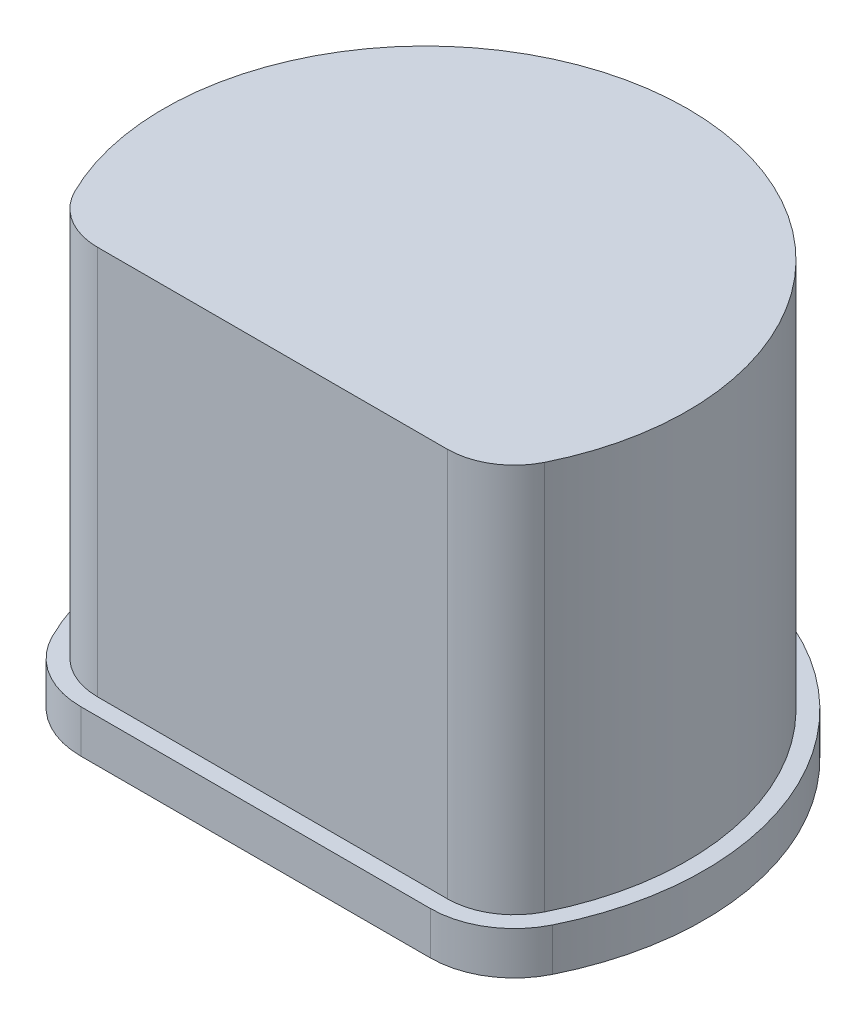
from build123d import *

# Parameters (mm, degrees)
BOSS_EXTRUDE1_DEPTH = 14.54
BOSS_EXTRUDE2_DEPTH = 1.6
SKETCH5_W           = 12.35
SKETCH5_H           = 4.1
BOSS_EXTRUDE3_DEPTH = 2.45


with BuildPart() as part:
    # Sketch1 → Boss-Extrude1 (new body)
    with BuildSketch(Plane(origin=(0, 0, 0), x_dir=(1, 0, 0), z_dir=(0, 1, 0))):
        with BuildLine():
            Line((-6.529165337, -5.72), (6.529165337, -5.72))
            ThreePointArc((6.529165337, -5.72), (7.849312473, -5.343019439), (8.771323763, -4.325769231))
            ThreePointArc((8.771323763, -4.325769231), (0, 9.78), (-8.771323763, -4.325769231))
            ThreePointArc((-8.771323763, -4.325769231), (-7.849312473, -5.343019439), (-6.529165337, -5.72))
        make_face()
    extrude(amount=BOSS_EXTRUDE1_DEPTH)

    # Sketch3 → Boss-Extrude2 (add)
    with BuildSketch(Plane.XZ):
        with BuildLine():
            Line((6.529165337, 6.35), (-6.529165337, 6.35))
            ThreePointArc((-6.529165337, 6.35), (-8.181989552, 5.878020338), (-9.336347687, 4.604423077))
            ThreePointArc((-9.336347687, 4.604423077), (0, -10.41), (9.336347687, 4.604423077))
            ThreePointArc((9.336347687, 4.604423077), (8.181989552, 5.878020338), (6.529165337, 6.35))
        make_face()
    extrude(amount=BOSS_EXTRUDE2_DEPTH)

    # Sketch5 → Boss-Extrude3 (add)
    with BuildSketch(Plane.XZ.offset(1.6)):
        Rectangle(SKETCH5_W, SKETCH5_H)
    extrude(amount=BOSS_EXTRUDE3_DEPTH)


solid = part.part
